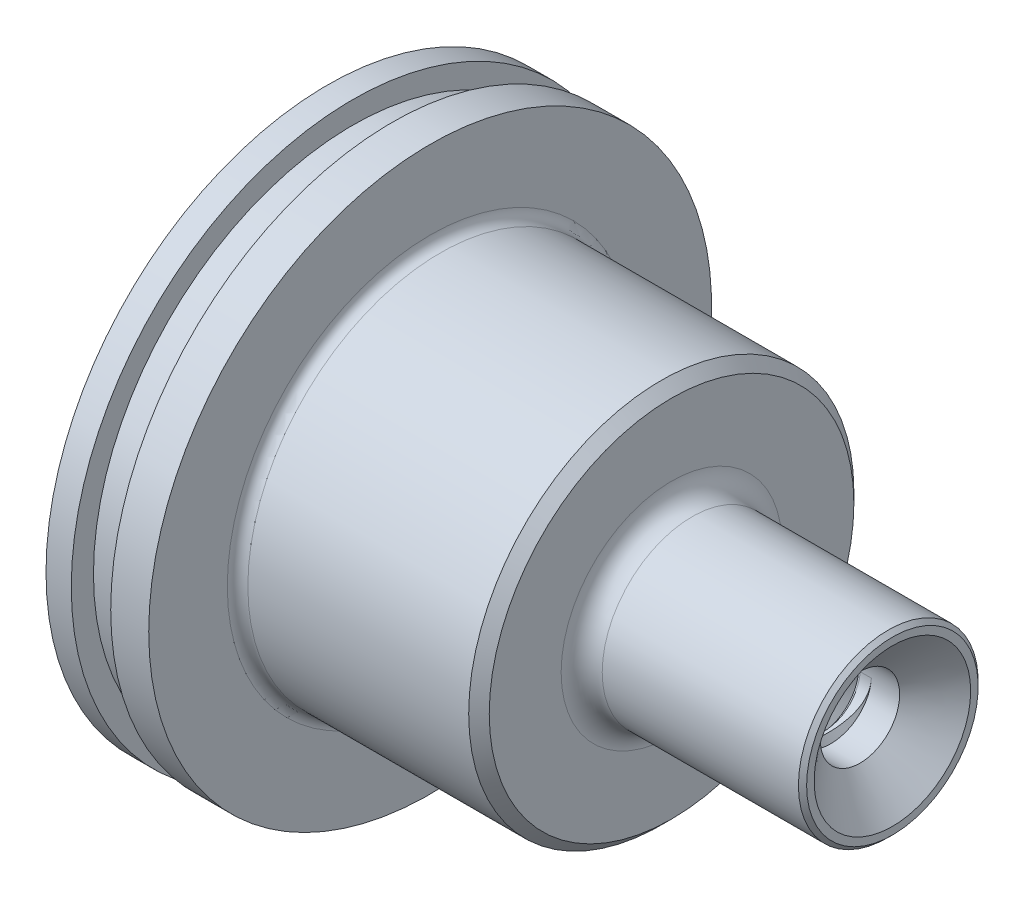
from build123d import *

# Parameters (mm, degrees)
FILLET1_R                                           = 1.27
FILLET2_R                                           = 2.54
CHAMFER1_SIZE                                       = 1.27
CHAMFER2_SIZE                                       = 0.508
CSK_FOR_3_8_FLAT_HEAD_MACHINE_SCREW_100_D           = 9.8044
CSK_FOR_3_8_FLAT_HEAD_MACHINE_SCREW_100_DEPTH       = 25.4
CSK_FOR_3_8_FLAT_HEAD_MACHINE_SCREW_100_CSINK_D     = 19.3548
CSK_FOR_3_8_FLAT_HEAD_MACHINE_SCREW_100_CSINK_ANGLE = 100
CSK_FOR_3_8_FLAT_HEAD_MACHINE_SCREW_100_TIP         = 2.945538927
THREAD1_PITCH                                       = 1.5875
CUT_EXTRUDE1_DEPTH                                  = 9.017


with BuildPart() as part:
    # Sketch1 → Revolve1 (revolve)
    with BuildSketch(Plane.XY, mode=Mode.PRIVATE) as revolve1_sk:
        Polygon((38.1, 0), (69.85, 0), (69.85, 11.1125), (42.545, 11.1125), (42.545, 23.8125), (12.7, 23.8125), (12.7, 34.798), (8.001, 34.798), (8.001, 32.0548), (3.1242, 32.0548), (3.1242, 34.798), (0, 34.798), (0, 19.05), (38.1, 19.05), align=None)
    revolve(revolve1_sk.sketch.rotate(Axis((38.1, 0, 0), (1, 0, 0)), 90), axis=Axis((38.1, 0, 0), (1, 0, 0)))

    # Fillet1
    fillet1_edges = [part.edges().sort_by_distance(p)[0] for p in [
        (12.7, 0, -23.8125),
    ]]
    fillet(fillet1_edges, radius=FILLET1_R)

    # Fillet2
    fillet2_edges = [part.edges().sort_by_distance(p)[0] for p in [
        (42.545, 0, -11.1125),
    ]]
    fillet(fillet2_edges, radius=FILLET2_R)

    # Chamfer1
    chamfer1_edges = [part.edges().sort_by_distance(p)[0] for p in [
        (42.545, 0, -23.8125),
    ]]
    chamfer(chamfer1_edges, length=CHAMFER1_SIZE)

    # Chamfer2
    chamfer2_edges = [part.edges().sort_by_distance(p)[0] for p in [
        (69.85, 0, -11.1125),
    ]]
    chamfer(chamfer2_edges, length=CHAMFER2_SIZE)

    # CSK for 3/8 Flat Head Machine Screw (100)1
    with Locations(Plane(origin=(69.85, 0, 0), x_dir=(0, 0, -1), z_dir=(1, 0, 0))):
        with Locations((0, 0)):
            CounterSinkHole(CSK_FOR_3_8_FLAT_HEAD_MACHINE_SCREW_100_D / 2, CSK_FOR_3_8_FLAT_HEAD_MACHINE_SCREW_100_CSINK_D / 2, depth=CSK_FOR_3_8_FLAT_HEAD_MACHINE_SCREW_100_DEPTH, counter_sink_angle=CSK_FOR_3_8_FLAT_HEAD_MACHINE_SCREW_100_CSINK_ANGLE)
            with Locations((0, 0, -(CSK_FOR_3_8_FLAT_HEAD_MACHINE_SCREW_100_DEPTH + CSK_FOR_3_8_FLAT_HEAD_MACHINE_SCREW_100_TIP / 2))):  # 118° drill point
                Cone(0, CSK_FOR_3_8_FLAT_HEAD_MACHINE_SCREW_100_D / 2, CSK_FOR_3_8_FLAT_HEAD_MACHINE_SCREW_100_TIP, mode=Mode.SUBTRACT)

    # Thread1: the profile of Thread Profile1 profile screwed along a right-hand helix of 12 turns, 8 arcs to a turn; built about Z, then put on its axis
    thread1_z = Axis((0, 0, 0), (0, 0, 1))
    thread1_corners = [(4.9025, 0, -0.000173205), (4.9025, 0, 1.389235701), (4.042940423, 0, 0.892968748), (4.042940423, 0, 0.496093748)]
    with BuildLine(mode=Mode.PRIVATE) as thread1_profile:
        Line(thread1_corners[0], thread1_corners[1])
        Line(thread1_corners[1], thread1_corners[2])
        Line(thread1_corners[2], thread1_corners[3])
        Line(thread1_corners[3], thread1_corners[0])
    thread1_cap = Face(thread1_profile.wire())
    thread1_turn_angles = [0, 22.5, 45, 67.5, 90, 112.5, 135, 157.5, 180, 202.5, 225, 247.5, 270, 292.5, 315, 337.5, 360]
    thread1_turn_weights = [1, 0.9238795325112867, 1, 0.9238795325112867, 1, 0.9238795325112867, 1, 0.9238795325112867, 1, 0.9238795325112867, 1, 0.9238795325112867, 1, 0.9238795325112867, 1, 0.9238795325112867, 1]
    thread1_turn_rails = [Edge.make_bspline([Vector(p[0], p[1], 0).rotate(thread1_z, thread1_turn_angles[k]) / thread1_turn_weights[k] + Vector(0, 0, p[2] + THREAD1_PITCH * thread1_turn_angles[k] / 360) for k in range(17)], [0, 0, 0, 1, 1, 2, 2, 3, 3, 4, 4, 5, 5, 6, 6, 7, 7, 8, 8, 8], 2, thread1_turn_weights) for p in thread1_corners]
    thread1_turn_sides = [Face.make_surface_from_curves(thread1_turn_rails[p[0]], thread1_turn_rails[p[1]]) for p in [(0, 1), (1, 2), (2, 3), (3, 0)]]
    thread1 = Plane(origin=(41.91, 0, 0), x_dir=(0, 0, -1), z_dir=(1, 0, 0)) * Solid(Shell([*[p.moved(Location((0, 0, THREAD1_PITCH * i))) for i in range(12) for p in thread1_turn_sides], thread1_cap, thread1_cap.rotate(thread1_z, 4320).moved(Location((0, 0, THREAD1_PITCH * 4320 / 360)))]))
    add(thread1)

    # Sketch4 → Cut-Extrude1 (cut)
    with BuildSketch(Plane(origin=(69.85, 0, 0), x_dir=(0, 0, -1), z_dir=(1, 0, 0))):
        with BuildLine():
            Line((4.9022, 0), (4.042940423, 0))
            ThreePointArc((4.042940423, 0), (2.858790589, -2.858790589), (0, -4.042940423))
            add(Edge.make_bspline(
                [(4.9022, 0), (4.9022, -2.847676325), (2.094258939, -4.042940423), (0, -4.042940423)],
                knots=[0, 0, 0, 0, 1, 1, 1, 1], degree=3))
        make_face()
    extrude(amount=-CUT_EXTRUDE1_DEPTH, mode=Mode.SUBTRACT)


solid = part.part
